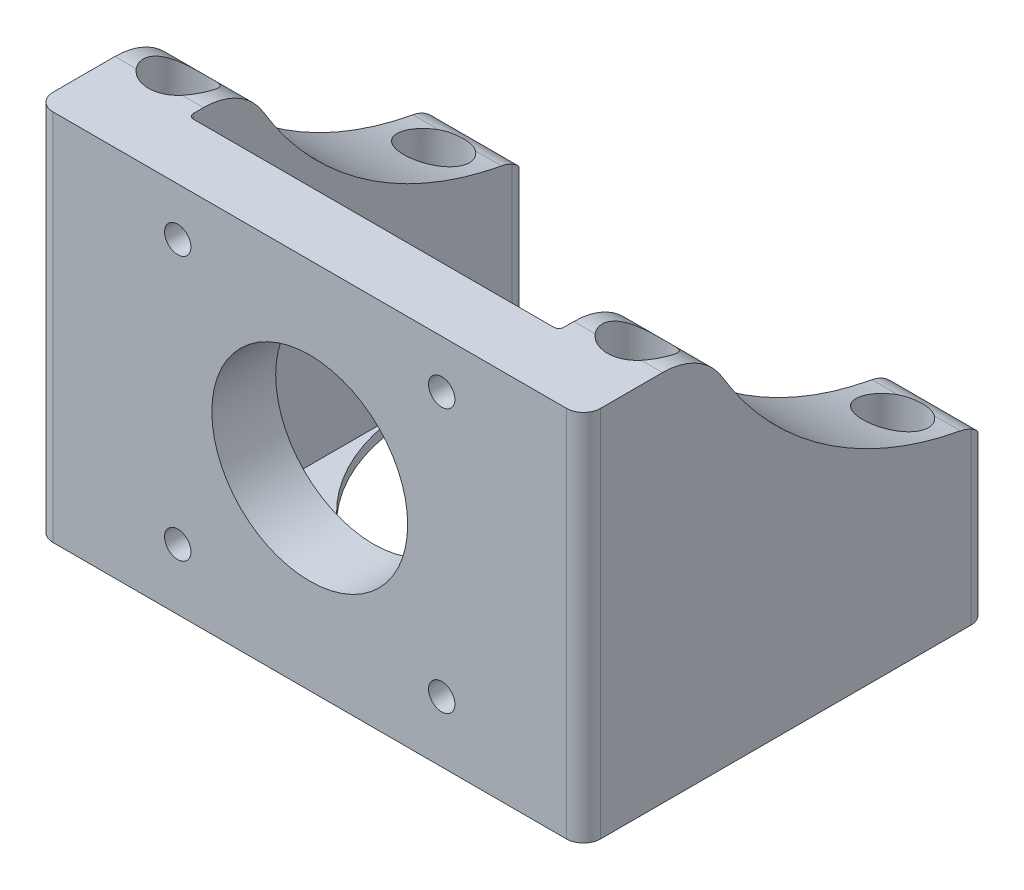
from build123d import *

# Parameters (mm, degrees)
SKETCH1_R               = 1.5499999999999976
SKETCH1_R_2             = 1.550000000000003
SKETCH1_R_3             = 1.5499999999999992
SKETCH1_R_4             = 11.5
BOSS_EXTRUDE1_DEPTH     = 7.5
SKETCH2_W               = 7.500000000000001
SKETCH2_H               = 42.30000000000015
BOSS_EXTRUDE2_DEPTH     = 11
CUT_EXTRUDE1_DEPTH      = 67.5049810164623
BOSS_EXTRUDE3_DEPTH     = 1.5
CUT_EXTRUDE2_DEPTH      = 68.46897435117893
CUT_EXTRUDE2_DEPTH_BACK = 68.46897435117893
SKETCH5_R               = 1.5000000000000007
SKETCH5_R_2             = 1.5000000000000009
CUT_EXTRUDE3_START      = -15
SKETCH5_3_R             = 3.500000000000001
SKETCH5_3_R_2           = 1.5000000000000009
SKETCH5_3_R_3           = 3.5
CUT_EXTRUDE3_DEPTH      = 47.50000000000001
FILLET2_R               = 2
SKETCH6_W               = 48.78690945060761
SKETCH6_H               = 41.74981882727384
BOSS_EXTRUDE4_DEPTH     = 1.2
CUT_EXTRUDE4_DEPTH      = 67.69619571572309


with BuildPart() as part:
    # Sketch1 → Boss-Extrude1 (new body)
    with BuildSketch(Plane.XY):
        Polygon((0, 21.150000000000077), (21.150000000000073, 21.150000000000077), (21.150000000000077, 8.327e-14), (21.150000000000507, -21.149999999999572), (8.554e-14, -21.14999999999992), (-21.149999999999924, -21.149999999999928), (-21.149999999999995, -2.69e-15), (-21.149999999999856, 21.150000000000222), align=None)
        with Locations((15.499999999999996, 15.5)):
            Circle(SKETCH1_R, mode=Mode.SUBTRACT)
        with Locations((15.500000000000005, -15.500000000000002)):
            Circle(SKETCH1_R_2, mode=Mode.SUBTRACT)
        with Locations((-15.499999999999998, -15.500000000000012)):
            Circle(SKETCH1_R_3, mode=Mode.SUBTRACT)
        with Locations((-15.50000000000001, 15.49999999999999)):
            Circle(SKETCH1_R_3, mode=Mode.SUBTRACT)
        Circle(SKETCH1_R_4, mode=Mode.SUBTRACT)
    extrude(amount=BOSS_EXTRUDE1_DEPTH)

    # Sketch2 → Boss-Extrude2 (add)
    with BuildSketch(Plane.ZY.offset(21.149999999999995)):
        with Locations((3.7500000000000004, 2.1849e-13)):
            Rectangle(SKETCH2_W, SKETCH2_H)
        with BuildLine():
            Line((0, -21.14999999999986), (0, 21.150000000000293))
            Line((0, 21.150000000000293), (-1.771709500841494, 21.150000000000293))
            ThreePointArc((-1.7717095008414934, 21.150000000000297), (-5.828166751938932, 20.078151362319375), (-8.825687949345335, 17.14241097816094))
            ThreePointArc((-8.82568794934533, 17.142410978160935), (-20.697100679367818, 4.412586379453849), (-36.76838475660053, -2.2726737223876654))
            ThreePointArc((-36.76838475660055, -2.2726737223876654), (-39.086170348891756, -3.6262628829235943), (-40, -6.149999999999864))
            Line((-40, -6.149999999999864), (-40, -21.149999999999864))
            Line((-40, -21.149999999999864), (0, -21.149999999999856))
        make_face()
    boss_extrude2 = extrude(amount=BOSS_EXTRUDE2_DEPTH)

    # Sketch3 → Cut-Extrude1 (cut, symmetric)
    with BuildSketch(Plane(origin=(0, 21.150000000000077, 0), x_dir=(1, 0, 0), z_dir=(0, 1, 0))):
        with BuildLine():
            Line((-21.75000000000007, 0.5999999999999999), (-21.750000000000068, 41.938133152744264))
            Line((-21.750000000000068, 41.938133152744264), (-16.932175207311897, 41.938133152744264))
            Line((-16.932175207311897, 41.938133152744264), (-16.932175207311897, 2.9783080433489855))
            Line((-16.932175207311897, 2.9783080433489855), (-21.149999999999856, 0))
            ThreePointArc((-21.149999999999856, 0), (-21.574264068711923, 0.17573593128799603), (-21.75000000000007, 0.5999999999999999))
        make_face()
    cut_extrude1 = extrude(amount=CUT_EXTRUDE1_DEPTH, both=True, mode=Mode.SUBTRACT)

    # Mirror1: Boss-Extrude2, Cut-Extrude1 across plane
    add(boss_extrude2.mirror(Plane(origin=(0, 0, 0), x_dir=(0, 0, 1), z_dir=(1, 0, 0))))
    add(cut_extrude1.mirror(Plane(origin=(0, 0, 0), x_dir=(0, 0, 1), z_dir=(1, 0, 0))), mode=Mode.SUBTRACT)

    # Sketch4 → Boss-Extrude3 (add)
    with BuildSketch(Plane.XZ.offset(21.14999999999992)):
        with BuildLine():
            Line((21.74999999999972, -0.5999999999999999), (21.74999999999972, -39.99999999999999))
            Line((21.74999999999972, -39.99999999999999), (32.14999999999957, -40))
            Line((32.14999999999957, -40), (32.14999999999957, 7.5))
            Line((32.14999999999957, 7.5), (-32.15000000000027, 7.5))
            Line((-32.15000000000027, 7.5), (-32.15000000000027, -40))
            Line((-32.15000000000027, -40), (-21.750000000000423, -40))
            Line((-21.750000000000423, -40), (-21.750000000000416, -0.5999999999999998))
            ThreePointArc((-21.750000000000416, -0.5999999999999998), (-21.574264068712267, -0.17573593128799736), (-21.150000000000205, 0))
            Line((-21.150000000000205, 0), (21.14999999999951, 1.73e-15))
            ThreePointArc((21.14999999999951, 1.73e-15), (21.574264068711575, -0.17573593128799747), (21.74999999999972, -0.5999999999999999))
        make_face()
    extrude(amount=BOSS_EXTRUDE3_DEPTH)

    # Sketch5 → Cut-Extrude2 (cut, two sides: drawn at the far end of the back side and taken through both)
    with BuildSketch(Plane.XZ.offset(22.64999999999992).offset(-CUT_EXTRUDE2_DEPTH_BACK)):
        with Locations((-26.95000000000035, -4.0000000000000036)):
            Circle(SKETCH5_R)
        with Locations((-26.950000000000344, -34)):
            Circle(SKETCH5_R_2)
        with Locations((26.95000000000035, -33.99999999999999)):
            Circle(SKETCH5_R_2)
        with Locations((26.95000000000035, -3.9999999999999964)):
            Circle(SKETCH5_R)
    extrude(amount=CUT_EXTRUDE2_DEPTH + CUT_EXTRUDE2_DEPTH_BACK, mode=Mode.SUBTRACT)

    # Sketch5<3> → Cut-Extrude3 (cut)
    # profile 1 of 4: a face of its own
    with BuildSketch(Plane.XZ.offset(22.64999999999992).offset(CUT_EXTRUDE3_START)):
        with Locations((-26.950000000000344, -34)):
            Circle(SKETCH5_3_R)
        with Locations((-26.950000000000344, -34)):
            Circle(SKETCH5_3_R_2, mode=Mode.SUBTRACT)
    # profile 2 of 4: a face of its own
    with BuildSketch(Plane.XZ.offset(22.64999999999992).offset(CUT_EXTRUDE3_START)):
        with Locations((-26.95000000000035, -4.0000000000000036)):
            Circle(SKETCH5_3_R_3)
    # profile 3 of 4: a face of its own
    with BuildSketch(Plane.XZ.offset(22.64999999999992).offset(CUT_EXTRUDE3_START)):
        with Locations(Location((26.95000000000035, -3.9999999999999964, 0), (0, 0, 39.542798608))):
            Circle(SKETCH5_3_R_3)
    # profile 4 of 4: a face of its own
    with BuildSketch(Plane.XZ.offset(22.64999999999992).offset(CUT_EXTRUDE3_START)):
        with Locations(Location((26.95000000000035, -33.99999999999999, 0), (0, 0, 307.724020594))):
            Circle(SKETCH5_3_R)
    extrude(amount=-CUT_EXTRUDE3_DEPTH, mode=Mode.SUBTRACT)

    # Fillet2
    # the kernel refuses this fillet: 2 mm, written as the material it takes off along each edge
    with BuildSketch(Plane(origin=(32.1499999999999, -27.649999999999388, -40), x_dir=(0, 0, 1), z_dir=(1.72e-15, 1, 0))) as fillet2_piece_1:
        with BuildLine():
            CenterArc((FILLET2_R, -FILLET2_R), FILLET2_R, 90, 90)
            Line((0, -FILLET2_R), (0, 0))
            Line((0, 0), (FILLET2_R, 0))
        make_face()
    extrude(amount=26.499999999999414, mode=Mode.SUBTRACT)
    with BuildSketch(Plane(origin=(21.750000000000068, -1.1499999999999382, -40), x_dir=(0, 4.3e-16, 1), z_dir=(1.51e-15, -1, 4.3e-16))) as fillet2_piece_2:
        with BuildLine():
            CenterArc((FILLET2_R, -FILLET2_R), FILLET2_R, 90, 90)
            Line((0, -FILLET2_R), (0, 0))
            Line((0, 0), (FILLET2_R, 0))
        make_face()
    extrude(amount=26.499999999999623, mode=Mode.SUBTRACT)
    with BuildSketch(Plane(origin=(-32.149999999999984, -1.1499999999999746, -40), x_dir=(0, 0, 1), z_dir=(4.31e-15, -1, 0))) as fillet2_piece_3:
        with BuildLine():
            CenterArc((FILLET2_R, -FILLET2_R), FILLET2_R, 90, 90)
            Line((0, -FILLET2_R), (0, 0))
            Line((0, 0), (FILLET2_R, 0))
        make_face()
    extrude(amount=26.50000000000048, mode=Mode.SUBTRACT)
    with BuildSketch(Plane(origin=(-32.1499999999999, -27.650000000000453, 7.5), x_dir=(1, 3.73e-15, 0), z_dir=(-3.73e-15, 1, 0))) as fillet2_piece_4:
        with BuildLine():
            CenterArc((FILLET2_R, FILLET2_R), FILLET2_R, 180, 90)
            Line((0, FILLET2_R), (0, 0))
            Line((0, 0), (FILLET2_R, 0))
        make_face()
    extrude(amount=53.80000000000064, mode=Mode.SUBTRACT)
    with BuildSketch(Plane(origin=(-21.750000000000068, -27.650000000000283, -40), x_dir=(0, 0, 1), z_dir=(-1.08e-15, 1, 0))) as fillet2_piece_5:
        with BuildLine():
            CenterArc((FILLET2_R, -FILLET2_R), FILLET2_R, 90, 90)
            Line((0, -FILLET2_R), (0, 0))
            Line((0, 0), (FILLET2_R, 0))
        make_face()
    extrude(amount=26.50000000000034, mode=Mode.SUBTRACT)
    with BuildSketch(Plane(origin=(32.150000000000084, 26.150000000000183, 7.5), x_dir=(0, 0, -1), z_dir=(-2.76e-15, -1, 0))) as fillet2_piece_6:
        with BuildLine():
            CenterArc((FILLET2_R, -FILLET2_R), FILLET2_R, 90, 90)
            Line((0, -FILLET2_R), (0, 0))
            Line((0, 0), (FILLET2_R, 0))
        make_face()
    extrude(amount=53.79999999999957, mode=Mode.SUBTRACT)

    # Sketch6 → Boss-Extrude4 (add)
    with BuildSketch(Plane.XZ.offset(22.64999999999992)):
        with Locations((-0.09860427356243306, -19.12509058636308)):
            Rectangle(SKETCH6_W, SKETCH6_H)
    extrude(amount=-BOSS_EXTRUDE4_DEPTH)

    # Sketch7 → Cut-Extrude4 (cut, through all)
    with BuildSketch(Plane(origin=(3.5542e-13, -21.44999999999992, 0), x_dir=(1, 1.657e-14, 0), z_dir=(-1.657e-14, 1, 0))):
        with BuildLine():
            Line((21.75000000000003, 36.768384756600554), (21.74999999999979, 26.401553875860724))
            ThreePointArc((21.74999999999979, 26.401553875860724), (-4e-15, 4.651553875860934), (-21.74999999999979, 26.401553875860724))
            Line((-21.74999999999979, 26.401553875860724), (-21.750000000000107, 36.76838475660055))
            Line((-21.750000000000107, 36.76838475660055), (-21.750000000000114, 38))
            ThreePointArc((-21.750000000000114, 38), (-22.335786437627018, 39.41421356237322), (-23.750000000000167, 40))
            Line((-23.750000000000167, 40), (-23.750000000000167, 46.1872525671472))
            Line((-23.750000000000167, 46.1872525671472), (23.749999999999964, 46.1872525671472))
            Line((23.749999999999964, 46.1872525671472), (23.749999999999964, 40))
            ThreePointArc((23.749999999999964, 40), (22.33578643762671, 39.414213562373185), (21.75000000000002, 38))
            Line((21.75000000000002, 38), (21.75000000000003, 36.768384756600554))
        make_face()
    extrude(amount=-CUT_EXTRUDE4_DEPTH, mode=Mode.SUBTRACT)


solid = part.part
